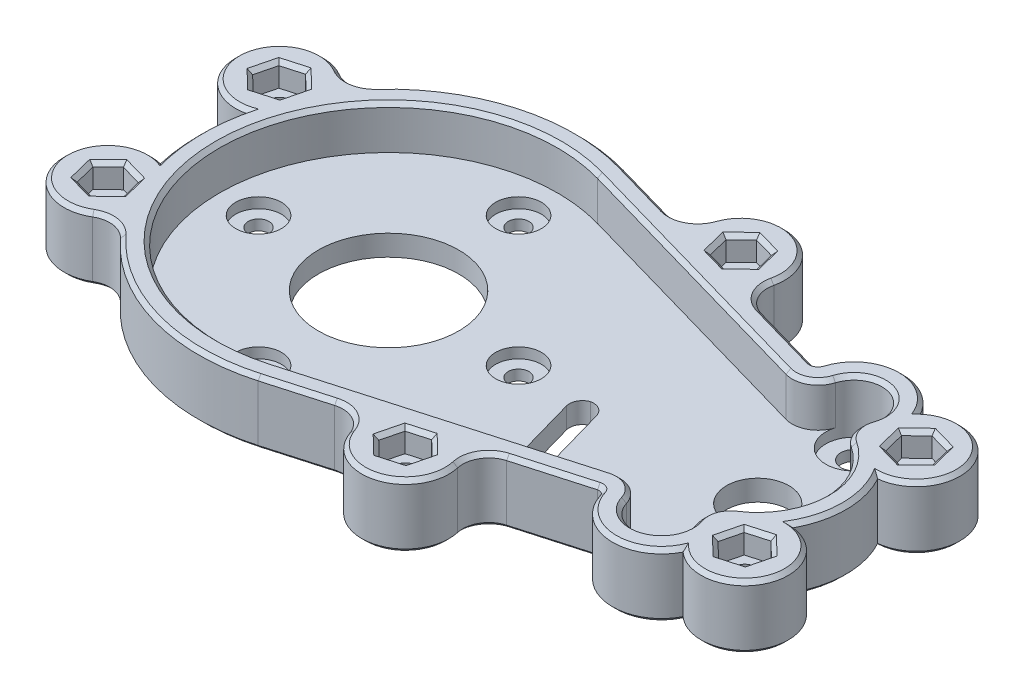
from build123d import *

# Parameters (mm, degrees)
SKETCH1_W               = 200
SKETCH1_H               = 150
SKETCH1_R               = 6
SKETCH1_R_2             = 13.5
SKETCH1_R_3             = 2
SKETCH1_R_4             = 2.5
BOSS_EXTRUDE1_DEPTH     = 4
SKETCH3_W               = 200
SKETCH3_H               = 150
BOSS_EXTRUDE2_DEPTH     = 8.25
SKETCH6_R               = 5.4
CUT_EXTRUDE2_DEPTH      = 8.25
FILLET1_R               = 2.5
FILLET2_R               = 5
SKETCH2_R               = 4.4
SKETCH2_R_2             = 5.4
CUT_EXTRUDE1_DEPTH      = 2
CUT_EXTRUDE3_DEPTH      = 126.598815828
CUT_EXTRUDE3_DEPTH_BACK = 126.598815828
SKETCH8_R               = 2
CUT_EXTRUDE6_DEPTH      = 126.598815818
CUT_EXTRUDE6_DEPTH_BACK = 126.598815818
SKETCH13_OUTSIDE_W      = 252.06
SKETCH13_OUTSIDE_H      = 202.06
FILLET4_R               = 5
CUT_EXTRUDE7_DEPTH      = 4.5
CHAMFER1_SIZE           = 0.75


with BuildPart() as part:
    # Sketch1 → Boss-Extrude1 (new body)
    with BuildSketch(Plane(origin=(0, 0, 0), x_dir=(1, 0, 0), z_dir=(0, 1, 0))):
        Rectangle(SKETCH1_W, SKETCH1_H)
        with Locations(Location((35.5, 0, 0), (0, 0, 270))):
            Circle(SKETCH1_R, mode=Mode.SUBTRACT)
        with Locations(Location((-35.5, 0, 0), (0, 0, 270))):
            Circle(SKETCH1_R_2, mode=Mode.SUBTRACT)
        with Locations(Location((-60.5, 0, 0), (0, 0, 270))):
            Circle(SKETCH1_R_3, mode=Mode.SUBTRACT)
        with Locations(Location((-35.5, 25, 0), (0, 0, 270))):
            Circle(SKETCH1_R_3, mode=Mode.SUBTRACT)
        with Locations(Location((-10.5, 0, 0), (0, 0, 270))):
            Circle(SKETCH1_R_3, mode=Mode.SUBTRACT)
        with Locations(Location((-35.5, -25, 0), (0, 0, 270))):
            Circle(SKETCH1_R_3, mode=Mode.SUBTRACT)
        with Locations(Location((35.5, 18.5, 0), (0, 0, 270))):
            Circle(SKETCH1_R_4, mode=Mode.SUBTRACT)
        with Locations(Location((35.5, -18.5, 0), (0, 0, 90))):
            Circle(SKETCH1_R_4, mode=Mode.SUBTRACT)
        Polygon((4.517711304, -15.136418767), (0.159242352, 0.258507293), (4.681501882, 1.538807548), (9.039970835, -13.856118512), (9.584779454, -15.78048427), (5.062519924, -17.060784524), align=None, mode=Mode.SUBTRACT)
    extrude(amount=BOSS_EXTRUDE1_DEPTH)

    # Sketch3 → Boss-Extrude2 (add)
    with BuildSketch(Plane(origin=(0, 4, 0), x_dir=(1, 0, 0), z_dir=(0, 1, 0))):
        Rectangle(SKETCH3_W, SKETCH3_H)
        with BuildLine():
            Line((-26.573943662, 31.250208291), (39.070422535, 12.500083317))
            ThreePointArc((39.070422535, 12.500083317), (48.5, 0), (39.070422535, -12.500083317))
            Line((39.070422535, -12.500083317), (-26.573943662, -31.250208291))
            ThreePointArc((-26.573943662, -31.250208291), (-68, 0), (-26.573943662, 31.250208291))
        make_face(mode=Mode.SUBTRACT)
    extrude(amount=BOSS_EXTRUDE2_DEPTH)

    # Sketch6 → Cut-Extrude2 (cut)
    with BuildSketch(Plane(origin=(0, 12.25, 0), x_dir=(1, 0, 0), z_dir=(0, 1, 0))):
        with Locations((35.5, 18.5)):
            Circle(SKETCH6_R)
        with Locations((35.5, -18.5)):
            Circle(SKETCH6_R)
    extrude(amount=-CUT_EXTRUDE2_DEPTH, mode=Mode.SUBTRACT)

    # Fillet1
    # the kernel refuses this fillet: 2.5 mm, written as the material it adds along each edge
    with BuildSketch(Plane(origin=(9.584779454, 0, 15.78048427), x_dir=(-0.9621828787440704, 0, 0.2724043095323078), z_dir=(0, 1, 0)), Plane(origin=(5.062519924, 0, 17.060784524), x_dir=(-0.2724043095323296, 0, -0.9621828787440644), z_dir=(0, 1, 0)), Plane(origin=(4.681501882, 0, -1.538807548), x_dir=(0.2724043095323091, 0, 0.96218287874407), z_dir=(0, 1, 0))) as fillet1_piece_1:
        with BuildLine():
            CenterArc((FILLET1_R, -FILLET1_R), FILLET1_R, 90, 90)
            Line((0, -FILLET1_R), (0, 0))
            Line((0, 0), (FILLET1_R, 0))
        make_face()
    extrude(amount=4)
    with BuildSketch(Plane(origin=(0.159242352, 0, -0.258507293), x_dir=(0.272404309532306, 0, 0.962182878744071), z_dir=(0, 1, 0))) as fillet1_piece_2:
        with BuildLine():
            CenterArc((FILLET1_R, FILLET1_R), FILLET1_R, 180, 90)
            Line((0, FILLET1_R), (0, 0))
            Line((0, 0), (FILLET1_R, 0))
        make_face()
    extrude(amount=4)

    # Fillet2
    fillet2_edges = [part.edges().sort_by_distance(p)[0] for p in [
        (31.784909874, 8.125, 14.581058133),
        (36.584743308, 8.125, 13.210072594),
        (36.584743308, 8.125, -13.210072594),
        (31.784909874, 8.125, -14.581058133),
    ]]
    fillet(fillet2_edges, radius=FILLET2_R)

    # Sketch2 → Cut-Extrude1 (cut)
    with BuildSketch(Plane(origin=(0, 4, 0), x_dir=(1, 0, 0), z_dir=(0, 1, 0))):
        with Locations(Location((-35.5, 25, 0), (0, 0, 270))):
            Circle(SKETCH2_R)
        with Locations(Location((-10.5, 0, 0), (0, 0, 270))):
            Circle(SKETCH2_R)
        with Locations(Location((-35.5, -25, 0), (0, 0, 270))):
            Circle(SKETCH2_R)
        with Locations(Location((-60.5, 0, 0), (0, 0, 270))):
            Circle(SKETCH2_R)
        with Locations(Location((35.5, 18.5, 0), (0, 0, 270))):
            Circle(SKETCH2_R_2)
        with Locations(Location((35.5, -18.5, 0), (0, 0, 197.105868404))):
            Circle(SKETCH2_R_2)
    extrude(amount=-CUT_EXTRUDE1_DEPTH, mode=Mode.SUBTRACT)

    # Sketch8 → Cut-Extrude3 (cut, two sides: drawn at the far end of the back side and taken through both)
    with BuildSketch(Plane.XZ.offset(-CUT_EXTRUDE3_DEPTH_BACK)):
        with Locations(Location((49.5, 16.5, 0), (0, 0, 270))):
            Circle(SKETCH8_R)
        with Locations(Location((-73, 16.5, 0), (0, 0, 270))):
            Circle(SKETCH8_R)
        with Locations(Location((0, 32.25, 0), (0, 0, 270))):
            Circle(SKETCH8_R)
        with Locations(Location((-73, -16.5, 0), (0, 0, 270))):
            Circle(SKETCH8_R)
        with Locations(Location((0, -32.25, 0), (0, 0, 270))):
            Circle(SKETCH8_R)
        with Locations(Location((49.5, -16.5, 0), (0, 0, 270))):
            Circle(SKETCH8_R)
    extrude(amount=CUT_EXTRUDE3_DEPTH + CUT_EXTRUDE3_DEPTH_BACK, mode=Mode.SUBTRACT)

    # Sketch13 outside → Cut-Extrude6 (cut, two sides: drawn at the far end of the back side and taken through both)
    with BuildSketch(Plane(origin=(0, 12.25, 0), x_dir=(1, 0, 0), z_dir=(0, 1, 0)).offset(-CUT_EXTRUDE6_DEPTH_BACK)):
        Rectangle(SKETCH13_OUTSIDE_W, SKETCH13_OUTSIDE_H)
        with BuildLine():
            Line((-8.131291348, 30.142370761), (-25.475352113, 35.096387773))
            ThreePointArc((-25.475352113, 35.096387773), (-47.910899113, 34.325203324), (-65.651791262, 20.569868344))
            ThreePointArc((-65.651791262, 20.569868344), (-80.688646272, 19.88300436), (-71.036099712, 8.332803684))
            ThreePointArc((-71.036099712, 8.332803684), (-72, 0), (-71.036099712, -8.332803684))
            ThreePointArc((-71.036099712, -8.332803684), (-80.688646272, -19.88300436), (-65.651791262, -20.569868344))
            ThreePointArc((-65.651791262, -20.569868344), (-47.910899113, -34.325203324), (-25.475352113, -35.096387773))
            Line((-25.475352113, -35.096387773), (-8.131291348, -30.142370761))
            ThreePointArc((-8.131291348, -30.142370761), (2.307042254, -40.326976912), (5.791389082, -26.165609111))
            Line((5.791389082, -26.165609111), (25.285418022, -20.597492606))
            ThreePointArc((25.285418022, -20.597492606), (26.036864948, -20.680025145), (26.515828803, -21.264899257))
            ThreePointArc((26.515828803, -21.264899257), (34.700336728, -27.865924335), (43.885416553, -22.74791587))
            ThreePointArc((43.885416553, -22.74791587), (57.167099831, -19.931556524), (50.418811796, -8.150402112))
            ThreePointArc((50.418811796, -8.150402112), (52.5, 0), (50.418811796, 8.150402112))
            ThreePointArc((50.418811796, 8.150402112), (57.167099831, 19.931556524), (43.885416553, 22.74791587))
            ThreePointArc((43.885416553, 22.74791587), (34.700336728, 27.865924335), (26.515828803, 21.264899257))
            ThreePointArc((26.515828803, 21.264899257), (26.036864948, 20.680025145), (25.285418022, 20.597492606))
            Line((25.285418022, 20.597492606), (5.791389082, 26.165609111))
            ThreePointArc((5.791389082, 26.165609111), (2.307042254, 40.326976912), (-8.131291348, 30.142370761))
        make_face(mode=Mode.SUBTRACT)
    extrude(amount=CUT_EXTRUDE6_DEPTH + CUT_EXTRUDE6_DEPTH_BACK, mode=Mode.SUBTRACT)

    # Fillet4
    fillet4_edges = [part.edges().sort_by_distance(p)[0] for p in [
        (-65.651791262, 6.125, -20.569868344),
        (-8.131291348, 6.125, -30.142370761),
        (5.791389082, 6.125, -26.165609111),
        (5.791389082, 6.125, 26.165609111),
        (-8.131291348, 6.125, 30.142370761),
        (-65.651791262, 6.125, 20.569868344),
    ]]
    fillet(fillet4_edges, radius=FILLET4_R)

    # Sketch14 → Cut-Extrude7 (cut)
    with BuildSketch(Plane(origin=(0, 12.25, 0), x_dir=(1, 0, 0), z_dir=(0, 1, 0))):
        Polygon((2.987265878, 35.14071662), (-1.009801089, 36.282406448), (-3.997066967, 33.391689828), (-2.987265878, 29.35928338), (1.009801089, 28.217593552), (3.997066967, 31.108310172), align=None)
        Polygon((-2.987265878, -29.35928338), (-3.997066967, -33.391689828), (-1.009801089, -36.282406448), (2.987265878, -35.14071662), (3.997066967, -31.108310172), (1.009801089, -28.217593552), align=None)
        Polygon((52.487265878, 19.39071662), (48.490198911, 20.532406448), (45.502933033, 17.641689828), (46.512734122, 13.60928338), (50.509801089, 12.467593552), (53.497066967, 15.358310172), align=None)
        Polygon((53.497066967, -15.358310172), (50.509801089, -12.467593552), (46.512734122, -13.60928338), (45.502933033, -17.641689828), (48.490198911, -20.532406448), (52.487265878, -19.39071662), align=None)
        Polygon((-69.002933033, 17.641689828), (-71.990198911, 20.532406448), (-75.987265878, 19.39071662), (-76.997066967, 15.358310172), (-74.009801089, 12.467593552), (-70.012734122, 13.60928338), align=None)
        Polygon((-70.012734122, -13.60928338), (-74.009801089, -12.467593552), (-76.997066967, -15.358310172), (-75.987265878, -19.39071662), (-71.990198911, -20.532406448), (-69.002933033, -17.641689828), align=None)
    extrude(amount=-CUT_EXTRUDE7_DEPTH, mode=Mode.SUBTRACT)

    # Chamfer1
    chamfer1_edges = [part.edges().sort_by_distance(p)[0] for p in [
        (37.181420607, 12.25, 23.631551885),
        (48.5, 12.25, 0),
        (-1.193558594, 12.25, -24.000760707),
        (37.181420607, 12.25, -23.631551885),
        (27.944061099, 12.25, -17.163975823),
        (40.591655946, 12.25, -13.466055675),
        (27.944061099, 12.25, 17.163975823),
        (40.591655946, 12.25, 13.466055675),
        (-45.44485792, 12.25, 35.119080298),
        (18.4902483, 12.25, 22.538409837),
        (26.036864948, 12.25, 20.680025145),
        (34.700336728, 12.25, 27.865924335),
        (57.167099831, 12.25, 19.931556524),
        (52.5, 12.25, 0),
        (57.167099831, 12.25, -19.931556524),
        (34.700336728, 12.25, -27.865924335),
        (26.036864948, 12.25, -20.680025145),
        (-19.755166478, 12.25, -33.462520288),
        (-81.304080467, 12.25, -17.765799193),
        (-72, 12.25, 0),
        (-72, 0, 0),
        (-81.304080467, 0, 17.765799193),
        (-19.755166478, 0, 33.462520288),
        (26.036864948, 0, 20.680025145),
        (34.700336728, 0, 27.865924335),
        (57.167099831, 0, 19.931556524),
        (52.5, 0, 0),
        (57.167099831, 0, -19.931556524),
        (34.700336728, 0, -27.865924335),
        (26.036864948, 0, -20.680025145),
        (18.4902483, 0, -22.538409837),
        (-45.44485792, 0, -35.119080298),
        (2.307042254, 12.25, -40.326976912),
        (2.307042254, 0, -40.326976912),
        (-19.755166478, 0, -33.462520288),
        (18.4902483, 12.25, -22.538409837),
        (2.307042254, 12.25, 40.326976912),
        (2.307042254, 0, 40.326976912),
        (18.4902483, 0, 22.538409837),
        (-19.755166478, 12.25, 33.462520288),
        (-81.304080467, 12.25, 17.765799193),
        (-45.44485792, 0, 35.119080298),
        (-45.44485792, 12.25, -35.119080298),
        (-81.304080467, 0, -17.765799193),
        (-10.35487685, 12.25, -32.200345605),
        (-10.35487685, 0, -32.200345605),
        (8.766483762, 12.25, -26.738675062),
        (8.766483762, 0, -26.738675062),
        (8.766483762, 12.25, 26.738675062),
        (8.766483762, 0, 26.738675062),
        (-10.35487685, 12.25, 32.200345605),
        (-10.35487685, 0, 32.200345605),
        (-65.401208588, 12.25, 23.05656851),
        (-65.401208588, 0, 23.05656851),
        (-65.401208588, 12.25, -23.05656851),
        (-65.401208588, 0, -23.05656851),
        (3.492166422, 12.25, -33.124513396),
        (0.988732394, 12.25, -35.711561534),
        (-2.503434028, 12.25, -34.837048138),
        (-3.492166422, 12.25, -31.375486604),
        (-0.988732394, 12.25, -28.788438466),
        (2.503434028, 12.25, -29.662951862),
        (-69.507833578, 12.25, 15.625486604),
        (-72.011267606, 12.25, 13.038438466),
        (-75.503434028, 12.25, 13.912951862),
        (-76.492166422, 12.25, 17.374513396),
        (-73.988732394, 12.25, 19.961561534),
        (-70.496565972, 12.25, 19.087048138),
        (52.992166422, 12.25, -17.374513396),
        (50.488732394, 12.25, -19.961561534),
        (46.996565972, 12.25, -19.087048138),
        (46.007833578, 12.25, -15.625486604),
        (48.511267606, 12.25, -13.038438466),
        (52.003434028, 12.25, -13.912951862),
        (-0.988732394, 12.25, 28.788438466),
        (-3.492166422, 12.25, 31.375486604),
        (-2.503434028, 12.25, 34.837048138),
        (0.988732394, 12.25, 35.711561534),
        (3.492166422, 12.25, 33.124513396),
        (2.503434028, 12.25, 29.662951862),
        (52.992166422, 12.25, 17.374513396),
        (52.003434028, 12.25, 13.912951862),
        (48.511267606, 12.25, 13.038438466),
        (46.007833578, 12.25, 15.625486604),
        (46.996565972, 12.25, 19.087048138),
        (50.488732394, 12.25, 19.961561534),
        (-69.507833578, 12.25, -15.625486604),
        (-70.496565972, 12.25, -19.087048138),
        (-73.988732394, 12.25, -19.961561534),
        (-76.492166422, 12.25, -17.374513396),
        (-75.503434028, 12.25, -13.912951862),
        (-72.011267606, 12.25, -13.038438466),
        (-68, 12.25, 0),
        (-1.193558594, 12.25, 24.000760707),
    ]]
    chamfer(chamfer1_edges, length=CHAMFER1_SIZE)


solid = part.part
